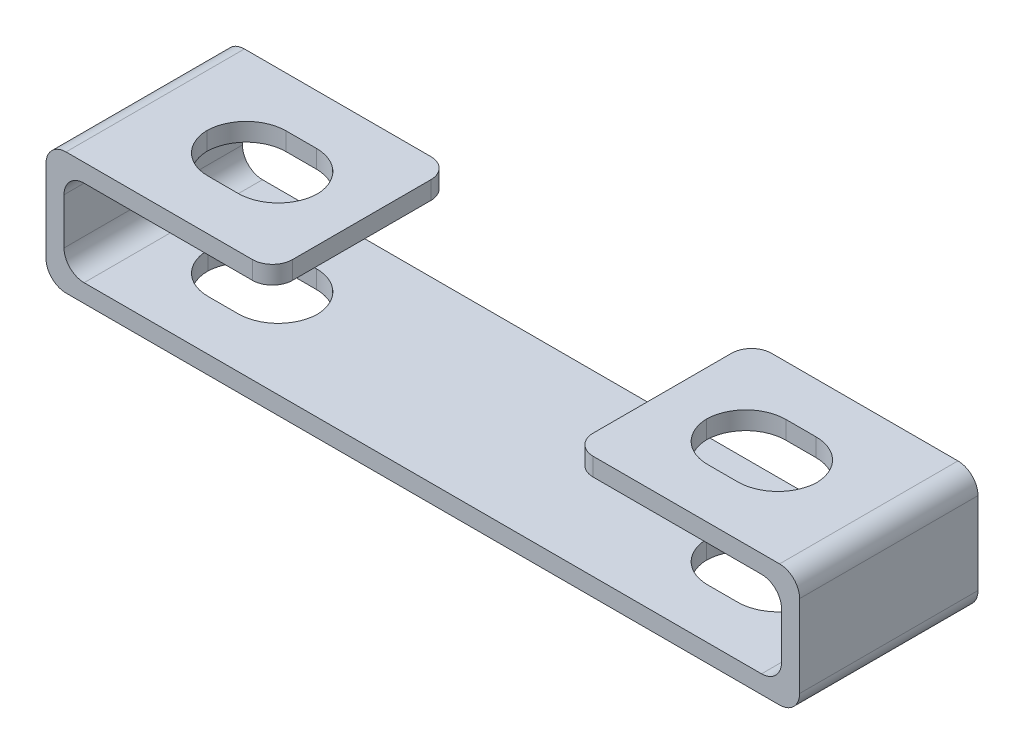
from build123d import *

# Parameters (mm, degrees)
CROQUIS1_W              = 37.6
CROQUIS1_H              = 6.1
SALIENTE_EXTRUIR1_DEPTH = 8.9
CROQUIS2_W              = 35.8
CROQUIS2_H              = 4.3
CROQUIS2_W_2            = 15
CROQUIS2_H_2            = 0.9
CORTAR_EXTRUIR2_DEPTH   = 8.9
CROQUIS3_W              = 5.5
CROQUIS3_H              = 3.9
CORTAR_EXTRUIR3_DEPTH   = 8.9
REDONDEO1_R             = 2
REDONDEO2_START         = 5.2
REDONDEO2_DEPTH         = 0.9
REDONDEO2_2_DEPTH       = 0.9
REDONDEO4_R             = 1
REDONDEO5_R             = 1
REDONDEO6_R             = 1
REDONDEO7_R             = 1
REDONDEO8_R             = 1
REDONDEO9_R             = 1
REDONDEO10_R            = 1
REDONDEO11_R            = 1
REDONDEO12_R            = 1
REDONDEO13_R            = 1
REDONDEO14_R            = 1
REDONDEO15_R            = 1


with BuildPart() as part:
    # Croquis1 → Saliente-Extruir1 (new body)
    with BuildSketch(Plane.XY):
        with Locations((18.8, 3.05)):
            Rectangle(CROQUIS1_W, CROQUIS1_H)
    extrude(amount=SALIENTE_EXTRUIR1_DEPTH)

    # Croquis2 → Cortar-Extruir2 (cut)
    with BuildSketch(Plane.XY.offset(8.9)):
        with Locations((18.8, 3.05)):
            Rectangle(CROQUIS2_W, CROQUIS2_H)
        with Locations((18.8, 5.65)):
            Rectangle(CROQUIS2_W_2, CROQUIS2_H_2)
    extrude(amount=-CORTAR_EXTRUIR2_DEPTH, mode=Mode.SUBTRACT)

    # Croquis3 → Cortar-Extruir3 (cut)
    with BuildSketch(Plane(origin=(0, 0, 0), x_dir=(1, 0, 0), z_dir=(0, 1, 0))):
        with Locations((6.335, -4.45)):
            Rectangle(CROQUIS3_W, CROQUIS3_H)
        with Locations((31.265, -4.45)):
            Rectangle(CROQUIS3_W, CROQUIS3_H)
    extrude(amount=CORTAR_EXTRUIR3_DEPTH, mode=Mode.SUBTRACT)

    # Redondeo1
    redondeo1_edges = [part.edges().sort_by_distance(p)[0] for p in [
        (3.585, 0.45, 6.4),
    ]]
    fillet(redondeo1_edges, radius=REDONDEO1_R)


with BuildPart() as redondeo2_tool:
    # Redondeo2: read off the stored shape, not the designer's step
    # Redondeo2 outline → Redondeo2 (new body)
    with BuildSketch(Plane(origin=(0, 0, 0), x_dir=(1, 0, 0), z_dir=(0, 1, 0)).offset(REDONDEO2_START)):
        with BuildLine():
            ThreePointArc((5.585, -6.4), (4.188575996, -5.831782106), (3.585625098, -4.45))
            ThreePointArc((3.585625098, -4.45), (4.187680846, -3.069091484), (5.582498438, -2.500001564))
            Line((5.582498438, -2.500001564), (3.585, -2.5))
            Line((3.585, -2.5), (3.585, -6.4))
            Line((3.585, -6.4), (5.585, -6.4))
        make_face()
        with BuildLine():
            ThreePointArc((9.084374902, -4.45), (8.481424004, -5.831782106), (7.085, -6.4))
            Line((7.085, -6.4), (9.085, -6.4))
            Line((9.085, -6.4), (9.085, -2.5))
            Line((9.085, -2.5), (7.085, -2.5))
            ThreePointArc((7.085, -2.5), (8.481424004, -3.068217894), (9.084374902, -4.45))
        make_face()
        with BuildLine():
            ThreePointArc((28.515625098, -4.45), (29.118575996, -3.068217894), (30.515, -2.5))
            Line((30.515, -2.5), (28.515, -2.5))
            Line((28.515, -2.5), (28.515, -6.4))
            Line((28.515, -6.4), (30.515, -6.4))
            ThreePointArc((30.515, -6.4), (29.118575996, -5.831782106), (28.515625098, -4.45))
        make_face()
        with BuildLine():
            Line((34.015, -2.5), (32.015, -2.5))
            ThreePointArc((32.015, -2.5), (33.411424004, -3.068217894), (34.014374902, -4.45))
            ThreePointArc((34.014374902, -4.45), (33.411424004, -5.831782106), (32.015, -6.4))
            Line((32.015, -6.4), (34.015, -6.4))
            Line((34.015, -6.4), (34.015, -2.5))
        make_face()
    extrude(amount=REDONDEO2_DEPTH)


with BuildPart() as part_1:
    add(part.part)


with BuildPart() as part_2:
    # Redondeo2: joined with redondeo2_tool
    add(part_1.part.fuse(redondeo2_tool.part, tol=0.00001))


with BuildPart() as redondeo2_2_tool:
    # Redondeo2 2 outline → Redondeo2 2 (new body)
    with BuildSketch(Plane(origin=(0, 0, 0), x_dir=(1, 0, 0), z_dir=(0, 1, 0))):
        with BuildLine():
            ThreePointArc((3.585, -4.4), (4.20409356, -3.050862325), (5.582498436, -2.5))
            Line((5.582498436, -2.5), (3.585, -2.5))
            Line((3.585, -2.5), (3.585, -4.4))
        make_face()
        with BuildLine():
            ThreePointArc((9.084374902, -4.45), (8.481424004, -5.831782106), (7.085, -6.4))
            Line((7.085, -6.4), (9.085, -6.4))
            Line((9.085, -6.4), (9.085, -2.5))
            Line((9.085, -2.5), (7.085, -2.5))
            ThreePointArc((7.085, -2.5), (8.481424004, -3.068217894), (9.084374902, -4.45))
        make_face()
        with BuildLine():
            ThreePointArc((28.515625098, -4.45), (29.118575996, -3.068217894), (30.515, -2.5))
            Line((30.515, -2.5), (28.515, -2.5))
            Line((28.515, -2.5), (28.515, -6.4))
            Line((28.515, -6.4), (30.515, -6.4))
            ThreePointArc((30.515, -6.4), (29.118575996, -5.831782106), (28.515625098, -4.45))
        make_face()
        with BuildLine():
            Line((34.015, -2.5), (32.015, -2.5))
            ThreePointArc((32.015, -2.5), (33.411424004, -3.068217894), (34.014374902, -4.45))
            ThreePointArc((34.014374902, -4.45), (33.411424004, -5.831782106), (32.015, -6.4))
            Line((32.015, -6.4), (34.015, -6.4))
            Line((34.015, -6.4), (34.015, -2.5))
        make_face()
    extrude(amount=REDONDEO2_2_DEPTH)


with BuildPart() as part_3:
    add(part_2.part)


with BuildPart() as part_4:
    # Redondeo2 2: joined with redondeo2_2_tool
    add(part_3.part.fuse(redondeo2_2_tool.part, tol=0.00001))

    # Redondeo4
    redondeo4_edges = [part_4.edges().sort_by_distance(p)[0] for p in [
        (0, 0, 4.45),
    ]]
    fillet(redondeo4_edges, radius=REDONDEO4_R)

    # Redondeo5
    redondeo5_edges = [part_4.edges().sort_by_distance(p)[0] for p in [
        (37.6, 0, 4.45),
    ]]
    fillet(redondeo5_edges, radius=REDONDEO5_R)

    # Redondeo6
    redondeo6_edges = [part_4.edges().sort_by_distance(p)[0] for p in [
        (37.6, 6.1, 4.45),
    ]]
    fillet(redondeo6_edges, radius=REDONDEO6_R)

    # Redondeo7
    redondeo7_edges = [part_4.edges().sort_by_distance(p)[0] for p in [
        (0, 6.1, 4.45),
    ]]
    fillet(redondeo7_edges, radius=REDONDEO7_R)

    # Redondeo8
    redondeo8_edges = [part_4.edges().sort_by_distance(p)[0] for p in [
        (0.9, 0.9, 4.45),
    ]]
    fillet(redondeo8_edges, radius=REDONDEO8_R)

    # Redondeo9
    redondeo9_edges = [part_4.edges().sort_by_distance(p)[0] for p in [
        (0.9, 5.2, 4.45),
    ]]
    fillet(redondeo9_edges, radius=REDONDEO9_R)

    # Redondeo10
    redondeo10_edges = [part_4.edges().sort_by_distance(p)[0] for p in [
        (36.7, 0.9, 4.45),
    ]]
    fillet(redondeo10_edges, radius=REDONDEO10_R)

    # Redondeo11
    redondeo11_edges = [part_4.edges().sort_by_distance(p)[0] for p in [
        (36.7, 5.2, 4.45),
    ]]
    fillet(redondeo11_edges, radius=REDONDEO11_R)

    # Redondeo12
    redondeo12_edges = [part_4.edges().sort_by_distance(p)[0] for p in [
        (26.3, 5.65, 8.9),
    ]]
    fillet(redondeo12_edges, radius=REDONDEO12_R)

    # Redondeo13
    redondeo13_edges = [part_4.edges().sort_by_distance(p)[0] for p in [
        (26.3, 5.65, 0),
    ]]
    fillet(redondeo13_edges, radius=REDONDEO13_R)

    # Redondeo14
    redondeo14_edges = [part_4.edges().sort_by_distance(p)[0] for p in [
        (11.3, 5.65, 0),
    ]]
    fillet(redondeo14_edges, radius=REDONDEO14_R)

    # Redondeo15
    redondeo15_edges = [part_4.edges().sort_by_distance(p)[0] for p in [
        (11.3, 5.65, 8.9),
    ]]
    fillet(redondeo15_edges, radius=REDONDEO15_R)


solid = part_4.part
